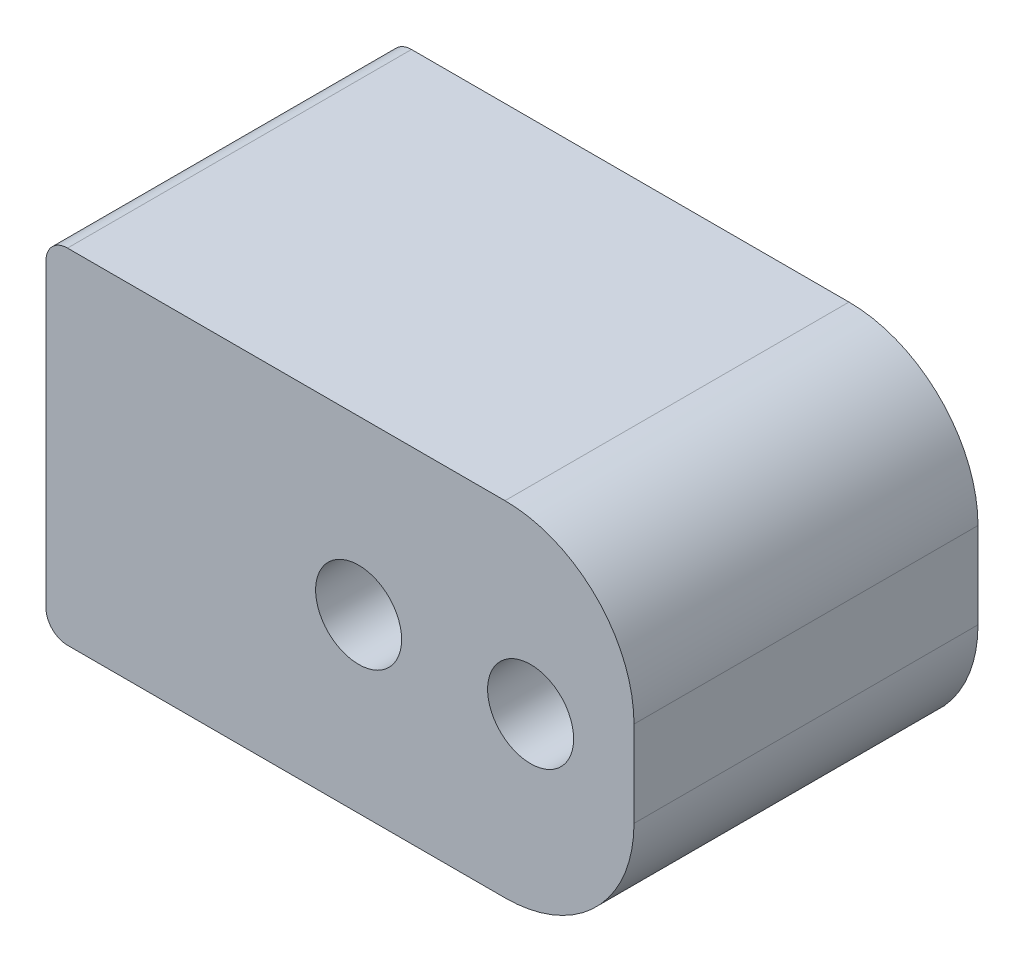
from build123d import *

# Parameters (mm, degrees)
SKETCH1_W           = 13.67451268
SKETCH1_H           = 8
SKETCH1_R           = 1
BOSS_EXTRUDE1_DEPTH = 8
CUT_EXTRUDE1_START  = -0.4
SKETCH2_R           = 3.15
CUT_EXTRUDE1_DEPTH  = 3.3
FILLET2_R           = 0.5
FILLET3_R           = 3


with BuildPart() as part:
    # Sketch1 → Boss-Extrude1 (new body)
    with BuildSketch(Plane.XY):
        with Locations((-0.43274366, 0)):
            Rectangle(SKETCH1_W, SKETCH1_H)
        Circle(SKETCH1_R, mode=Mode.SUBTRACT)
        with Locations((4, 0)):
            Circle(SKETCH1_R, mode=Mode.SUBTRACT)
    extrude(amount=BOSS_EXTRUDE1_DEPTH)

    # Sketch2 → Cut-Extrude1 (cut)
    with BuildSketch(Plane.ZY.offset(7.27).offset(CUT_EXTRUDE1_START)):
        with Locations((4, 0)):
            Circle(SKETCH2_R)
    extrude(amount=-CUT_EXTRUDE1_DEPTH, mode=Mode.SUBTRACT)

    # Fillet2
    fillet2_edges = [part.edges().sort_by_distance(p)[0] for p in [
        (-7.27, -4, 4),
        (-7.27, 4, 4),
    ]]
    fillet(fillet2_edges, radius=FILLET2_R)

    # Fillet3
    fillet3_edges = [part.edges().sort_by_distance(p)[0] for p in [
        (6.40451268, -4, 4),
        (6.40451268, 4, 4),
    ]]
    fillet(fillet3_edges, radius=FILLET3_R)


solid = part.part
